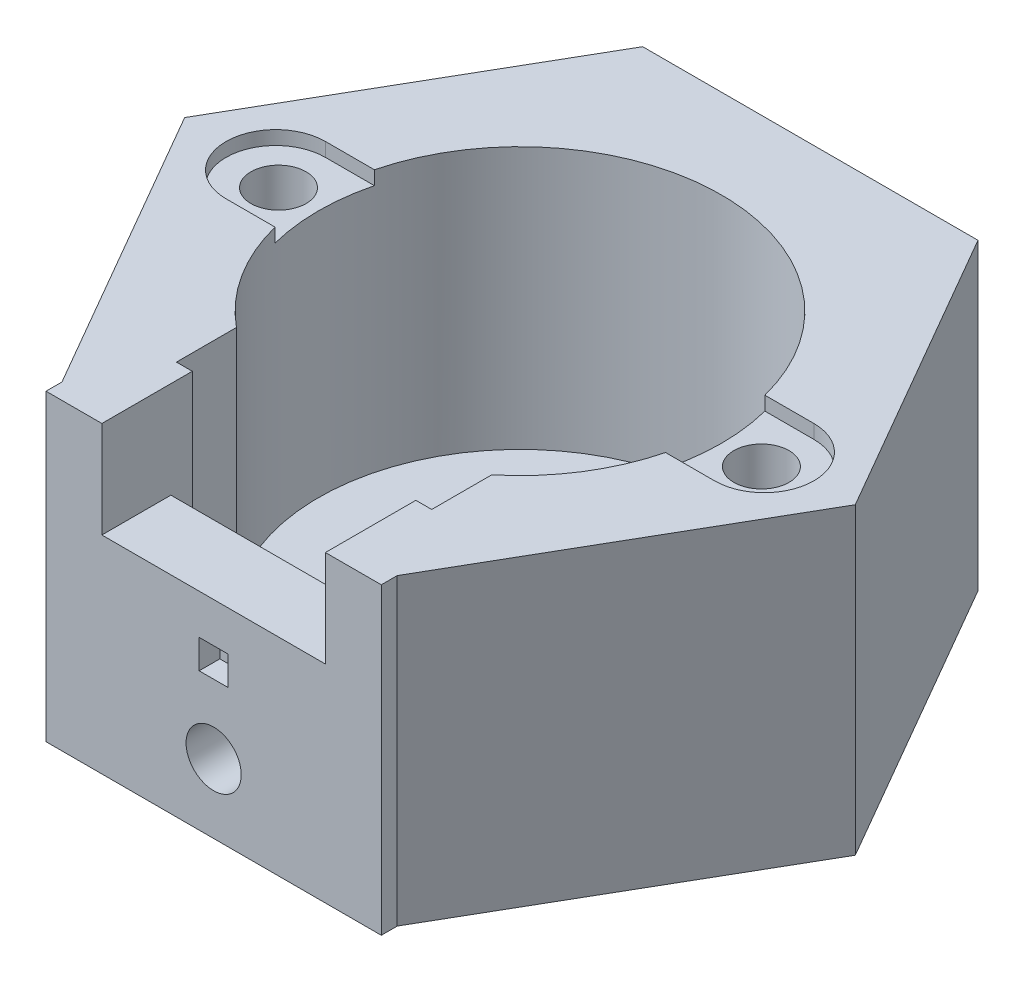
from build123d import *

# Parameters (mm, degrees)
BOSS_EXTRUDE12_DEPTH = 22
SKETCH1_14_R         = 2
BOSS_EXTRUDE13_DEPTH = 21
BOSS_EXTRUDE14_DEPTH = 3
SKETCH1_16_W         = 16.2
SKETCH1_16_H         = 1.552983906
BOSS_EXTRUDE15_DEPTH = 3
SKETCH1_17_W         = 16.2
SKETCH1_17_H         = 3.844417312
BOSS_EXTRUDE16_DEPTH = 15
SKETCH1_18_R         = 2
BOSS_EXTRUDE17_DEPTH = 18
SKETCH1_19_W         = 4.05
SKETCH1_19_H         = 1.155582688
BOSS_EXTRUDE18_DEPTH = 22
SKETCH1_20_W         = 16.2
SKETCH1_20_H         = 1.155582688
BOSS_EXTRUDE19_DEPTH = 15
SKETCH10_R           = 2
CUT_EXTRUDE6_DEPTH   = 3
SKETCH10_10_W        = 2.1
SKETCH10_10_H        = 2.1
CUT_EXTRUDE7_DEPTH   = 1.5
SKETCH1_21_W         = 18.5
SKETCH1_21_H         = 15.647016094
BOSS_EXTRUDE20_DEPTH = 3
CUT_EXTRUDE9_START   = -3
SKETCH13_R           = 2
CUT_EXTRUDE9_DEPTH   = 3
CUT_EXTRUDE10_START  = -1.5
SKETCH13_13_R        = 2
SKETCH13_13_W        = 2.1
SKETCH13_13_H        = 2.1
CUT_EXTRUDE10_DEPTH  = 1.5


with BuildPart() as part:
    # Sketch1 → Boss-Extrude12 (new body)
    with BuildSketch(Plane(origin=(0, 0, 0), x_dir=(1, 0, 0), z_dir=(0, 1, 0))):
        with BuildLine():
            ThreePointArc((-17.7, -3.6), (-21.3, 0), (-17.7, 3.6))
            Line((-17.7, 3.6), (-14.149204925, 3.6))
            ThreePointArc((-14.149204925, 3.6), (0, 14.6), (14.149204925, 3.6))
            Line((14.149204925, 3.6), (17.7, 3.6))
            ThreePointArc((17.7, 3.6), (21.3, 0), (17.7, -3.6))
            Line((17.7, -3.6), (14.149204925, -3.6))
            ThreePointArc((14.149204925, -3.6), (12.316145556, -7.840443778), (9.25, -11.295906338))
            Line((9.25, -11.295906338), (9.25, -15.647016094))
            Line((9.25, -15.647016094), (8.1, -15.647016094))
            Line((8.1, -15.647016094), (8.1, -17.2))
            Line((8.1, -17.2), (8.1, -21.044417312))
            Line((8.1, -21.044417312), (12.15, -21.044417312))
            Line((12.15, -21.044417312), (24.3, 0))
            Line((24.3, 0), (12.15, 21.044417312))
            Line((12.15, 21.044417312), (-12.15, 21.044417312))
            Line((-12.15, 21.044417312), (-24.3, 0))
            Line((-24.3, 0), (-12.15, -21.044417312))
            Line((-12.15, -21.044417312), (-8.1, -21.044417312))
            Line((-8.1, -21.044417312), (-8.1, -17.2))
            Line((-8.1, -17.2), (-8.1, -15.647016094))
            Line((-8.1, -15.647016094), (-9.25, -15.647016094))
            Line((-9.25, -15.647016094), (-9.25, -11.295906338))
            ThreePointArc((-9.25, -11.295906338), (-12.316145556, -7.840443778), (-14.149204925, -3.6))
            Line((-14.149204925, -3.6), (-17.7, -3.6))
        make_face()
    extrude(amount=BOSS_EXTRUDE12_DEPTH)

    # Sketch1<14> → Boss-Extrude13 (add)
    # profile 1 of 2: a face of its own
    with BuildSketch(Plane(origin=(0, 0, 0), x_dir=(1, 0, 0), z_dir=(0, 1, 0))):
        with BuildLine():
            Line((-14.149204925, 3.6), (-17.7, 3.6))
            ThreePointArc((-17.7, 3.6), (-21.3, 0), (-17.7, -3.6))
            Line((-17.7, -3.6), (-14.149204925, -3.6))
            ThreePointArc((-14.149204925, -3.6), (-14.6, 0), (-14.149204925, 3.6))
        make_face()
        with Locations((-17.5, 0)):
            Circle(SKETCH1_14_R, mode=Mode.SUBTRACT)
    # profile 2 of 2: a face of its own
    with BuildSketch(Plane(origin=(0, 0, 0), x_dir=(1, 0, 0), z_dir=(0, 1, 0))):
        with BuildLine():
            Line((17.7, 3.6), (14.149204925, 3.6))
            ThreePointArc((14.149204925, 3.6), (14.6, 0), (14.149204925, -3.6))
            Line((14.149204925, -3.6), (17.7, -3.6))
            ThreePointArc((17.7, -3.6), (21.3, 0), (17.7, 3.6))
        make_face()
        with Locations((17.5, 0)):
            Circle(SKETCH1_14_R, mode=Mode.SUBTRACT)
    extrude(amount=BOSS_EXTRUDE13_DEPTH)

    # Sketch1<15> → Boss-Extrude14 (add)
    with BuildSketch(Plane(origin=(0, 0, 0), x_dir=(1, 0, 0), z_dir=(0, 1, 0))):
        with BuildLine():
            ThreePointArc((14.149204925, 3.6), (0, 14.6), (-14.149204925, 3.6))
            ThreePointArc((-14.149204925, 3.6), (-14.6, 0), (-14.149204925, -3.6))
            ThreePointArc((-14.149204925, -3.6), (-12.316145556, -7.840443778), (-9.25, -11.295906338))
            Line((-9.25, -11.295906338), (-9.25, 0))
            Line((-9.25, 0), (9.25, 0))
            Line((9.25, 0), (9.25, -11.295906338))
            ThreePointArc((9.25, -11.295906338), (12.316145556, -7.840443778), (14.149204925, -3.6))
            ThreePointArc((14.149204925, -3.6), (14.6, 0), (14.149204925, 3.6))
        make_face()
    extrude(amount=BOSS_EXTRUDE14_DEPTH)

    # Sketch1<16> → Boss-Extrude15 (add)
    with BuildSketch(Plane(origin=(0, 0, 0), x_dir=(1, 0, 0), z_dir=(0, 1, 0))):
        with Locations((0, -16.423508047)):
            Rectangle(SKETCH1_16_W, SKETCH1_16_H)
    extrude(amount=BOSS_EXTRUDE15_DEPTH)

    # Sketch1<17> → Boss-Extrude16 (add)
    with BuildSketch(Plane(origin=(0, 0, 0), x_dir=(1, 0, 0), z_dir=(0, 1, 0))):
        with Locations((0, -19.122208656)):
            Rectangle(SKETCH1_17_W, SKETCH1_17_H)
    extrude(amount=BOSS_EXTRUDE16_DEPTH)

    # Sketch1<18> → Boss-Extrude17 (add)
    with BuildSketch(Plane(origin=(0, 0, 0), x_dir=(1, 0, 0), z_dir=(0, 1, 0))):
        with Locations((17.5, 0)):
            Circle(SKETCH1_18_R)
        with Locations((-17.5, 0)):
            Circle(SKETCH1_18_R)
    extrude(amount=BOSS_EXTRUDE17_DEPTH)

    # Sketch1<19> → Boss-Extrude18 (add)
    with BuildSketch(Plane(origin=(0, 0, 0), x_dir=(1, 0, 0), z_dir=(0, 1, 0))):
        with Locations((-10.125, -21.622208656)):
            Rectangle(SKETCH1_19_W, SKETCH1_19_H)
        with Locations((10.125, -21.622208656)):
            Rectangle(SKETCH1_19_W, SKETCH1_19_H)
    extrude(amount=BOSS_EXTRUDE18_DEPTH)

    # Sketch1<20> → Boss-Extrude19 (add)
    with BuildSketch(Plane(origin=(0, 0, 0), x_dir=(1, 0, 0), z_dir=(0, 1, 0))):
        with Locations((0, -21.622208656)):
            Rectangle(SKETCH1_20_W, SKETCH1_20_H)
    extrude(amount=BOSS_EXTRUDE19_DEPTH)

    # Sketch10 → Cut-Extrude6 (cut)
    with BuildSketch(Plane.XY.offset(22.2)):
        with Locations((0, 5)):
            Circle(SKETCH10_R)
    extrude(amount=-CUT_EXTRUDE6_DEPTH, mode=Mode.SUBTRACT)

    # Sketch10<10> → Cut-Extrude7 (cut)
    with BuildSketch(Plane.XY.offset(22.2)):
        with Locations((0, 11.05)):
            Rectangle(SKETCH10_10_W, SKETCH10_10_H)
    extrude(amount=-CUT_EXTRUDE7_DEPTH, mode=Mode.SUBTRACT)

    # Sketch1<21> → Boss-Extrude20 (add)
    with BuildSketch(Plane(origin=(0, 0, 0), x_dir=(1, 0, 0), z_dir=(0, 1, 0))):
        with Locations((0, -7.823508047)):
            Rectangle(SKETCH1_21_W, SKETCH1_21_H)
    extrude(amount=BOSS_EXTRUDE20_DEPTH)

    # Sketch13 → Cut-Extrude9 (cut)
    with BuildSketch(Plane(origin=(0, 0, -21.044417312), x_dir=(-1, 0, 0), z_dir=(0, 0, -1)).offset(CUT_EXTRUDE9_START)):
        with Locations((0, 5)):
            Circle(SKETCH13_R)
    extrude(amount=CUT_EXTRUDE9_DEPTH, mode=Mode.SUBTRACT)

    # Sketch13<13> → Cut-Extrude10 (cut)
    with BuildSketch(Plane(origin=(0, 0, -21.044417312), x_dir=(-1, 0, 0), z_dir=(0, 0, -1)).offset(CUT_EXTRUDE10_START)):
        with Locations((0, 5)):
            Circle(SKETCH13_13_R)
        with Locations((0, 11.05)):
            Rectangle(SKETCH13_13_W, SKETCH13_13_H)
    extrude(amount=CUT_EXTRUDE10_DEPTH, mode=Mode.SUBTRACT)


solid = part.part
